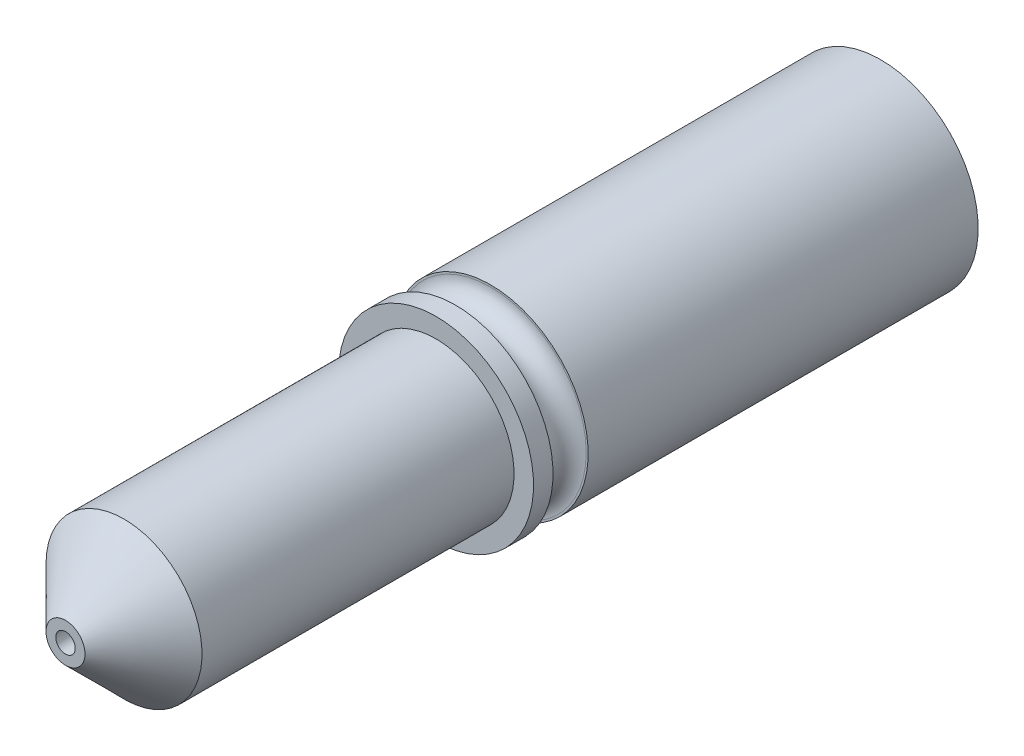
from build123d import *


with BuildPart() as part:
    # Sketch1 → Revolve1 (revolve)
    with BuildSketch(Plane(origin=(0, 0, 0), x_dir=(1, 0, 0), z_dir=(0, 1, 0))):
        with BuildLine():
            Line((0.25, -20.9), (0.5, -20.9))
            Line((0.5, -20.9), (2, -19.4))
            Line((2, -19.4), (2, -11.4))
            Line((2, -11.4), (2.5, -11.4))
            Line((2.5, -11.4), (2.5, -10.9))
            Line((2.5, -10.9), (2.45, -10.9))
            ThreePointArc((2.45, -10.9), (2, -10.45), (2.45, -10))
            Line((2.45, -10), (2.5, -10))
            Line((2.5, -10), (2.5, 0))
            Line((2.5, 0), (1.65, 0))
            Line((1.65, 0), (1.65, -9.8))
            Line((1.65, -9.8), (1, -9.8))
            Line((1, -9.8), (1, -19.55))
            Line((1, -19.55), (0.25, -20.3))
            Line((0.25, -20.3), (0.25, -20.9))
        make_face()
    revolve(axis=Axis((0, 0, 0), (0, 0, 1)))


solid = part.part
